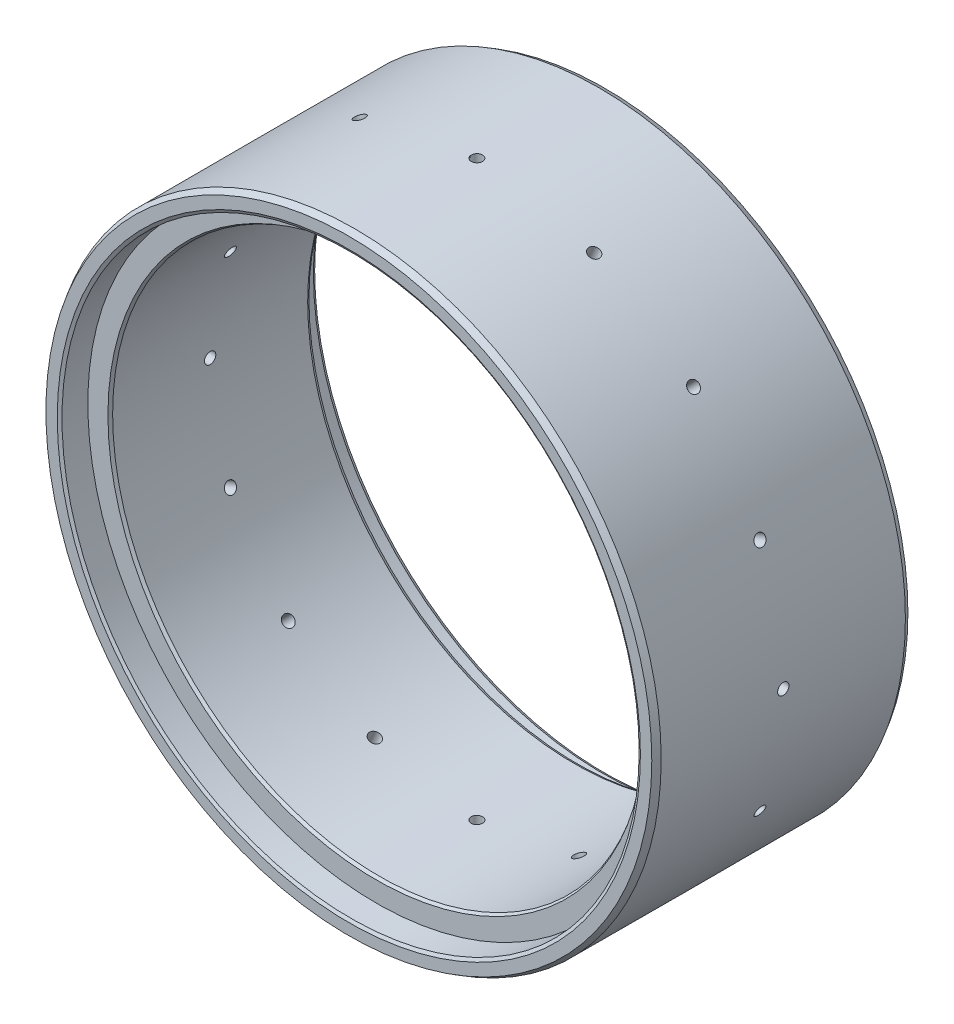
from build123d import *
from OCP.BRepFilletAPI import BRepFilletAPI_MakeChamfer

# Parameters (mm, degrees)
SKETCH1_R         = 67.7545
SKETCH1_R_2       = 58.9915
EXTRUDE1_DEPTH    = 28.321
SKETCH11_R        = 63.8175
EXTRUDE2_DEPTH    = 6.096
CIRPATTERN1_COUNT = 16
CHAMFER1_SIZE     = 0.381
CHAMFER1_SIZE2    = 0.659911358
CHAMFER3_SIZE     = 0.762
CHAMFER3_SIZE2    = 1.319822715


with BuildPart() as part:
    # Sketch1 → Extrude1 (new, symmetric)
    with BuildSketch(Plane.XY):
        Circle(SKETCH1_R)
        Circle(SKETCH1_R_2, mode=Mode.SUBTRACT)
    extrude(amount=EXTRUDE1_DEPTH, both=True)

    # Sketch11 → Extrude2 (cut)
    with BuildSketch(Plane(origin=(0, 0, -28.321), x_dir=(-1, 0, 0), z_dir=(0, 0, -1))):
        Circle(SKETCH11_R)
    extrude2 = extrude(amount=-EXTRUDE2_DEPTH, mode=Mode.SUBTRACT)

    # Mirror1: Extrude2 across plane
    add(extrude2.mirror(Plane.XY), mode=Mode.SUBTRACT)

    # Sketch4 → Tap Drill for M3x0.5 Tap1 (revolve, cut)
    with BuildSketch(Plane(origin=(0, 67.7545, 0), x_dir=(0, 0, 1), z_dir=(1, 0, 0))):
        Polygon((0, 0), (0, 10.911075774), (1.25, 10.16), (1.25, 0), align=None)
    tap_drill_for_m3x0_5_tap1 = revolve(axis=Axis((0, 74.1045, 0), (0, -1, 0)), mode=Mode.SUBTRACT)

    # CirPattern1: Tap Drill for M3x0.5 Tap1 ×16 about axis
    cirpattern1_axis = Axis((0, 0, 28.321), (0, 0, -1))
    for i in range(1, CIRPATTERN1_COUNT):
        add(tap_drill_for_m3x0_5_tap1.rotate(cirpattern1_axis, i * 360 / CIRPATTERN1_COUNT), mode=Mode.SUBTRACT)

    # Chamfer1: one chamfer whose edges measure the first distance from different faces: ONE call of the kernel's chamfer builder (chamfer() names one face for all edges)
    chamfer1_edges_1 = [part.edges().sort_by_distance(p)[0] for p in [
        (-58.9915, 0, -22.225),
    ]]
    chamfer1_side_1 = [part.faces().sort_by_distance(p)[0] for p in [
        (62.01246852, 0, -22.225),
    ]]
    chamfer1_edges_2 = [part.edges().sort_by_distance(p)[0] for p in [
        (63.8175, 0, 28.321),
    ]]
    chamfer1_side_2 = [part.faces().sort_by_distance(p)[0] for p in [
        (63.8175, 0, 25.273),
    ]]
    chamfer1_edges_3 = [part.edges().sort_by_distance(p)[0] for p in [
        (-58.9915, 0, 22.225),
    ]]
    chamfer1_side_3 = [part.faces().sort_by_distance(p)[0] for p in [
        (62.01246852, 0, 22.225),
    ]]
    chamfer1_edges_4 = [part.edges().sort_by_distance(p)[0] for p in [
        (63.8175, 0, -28.321),
    ]]
    chamfer1_side_4 = [part.faces().sort_by_distance(p)[0] for p in [
        (-65.838113344, 0, -28.321),
    ]]
    chamfer1 = BRepFilletAPI_MakeChamfer(part.part.solid().wrapped)
    for e in chamfer1_edges_1:
        chamfer1.Add(CHAMFER1_SIZE, CHAMFER1_SIZE2, e.wrapped, chamfer1_side_1[0].wrapped)  # the first distance lies on this face
    for e in chamfer1_edges_2:
        chamfer1.Add(CHAMFER1_SIZE, CHAMFER1_SIZE2, e.wrapped, chamfer1_side_2[0].wrapped)  # the first distance lies on this face
    for e in chamfer1_edges_3:
        chamfer1.Add(CHAMFER1_SIZE, CHAMFER1_SIZE2, e.wrapped, chamfer1_side_3[0].wrapped)  # the first distance lies on this face
    for e in chamfer1_edges_4:
        chamfer1.Add(CHAMFER1_SIZE, CHAMFER1_SIZE2, e.wrapped, chamfer1_side_4[0].wrapped)  # the first distance lies on this face
    add(Compound.cast(chamfer1.Shape()), mode=Mode.REPLACE)

    # Chamfer3: one chamfer whose edges measure the first distance from different faces: ONE call of the kernel's chamfer builder (chamfer() names one face for all edges)
    chamfer3_edges_1 = [part.edges().sort_by_distance(p)[0] for p in [
        (-67.7545, 0, 28.321),
    ]]
    chamfer3_side_1 = [part.faces().sort_by_distance(p)[0] for p in [
        (66.393798014, 0, 28.321),
    ]]
    chamfer3_edges_2 = [part.edges().sort_by_distance(p)[0] for p in [
        (-67.7545, 0, -28.321),
    ]]
    chamfer3_side_2 = [part.faces().sort_by_distance(p)[0] for p in [
        (66.114886656, 0, -28.321),
    ]]
    chamfer3 = BRepFilletAPI_MakeChamfer(part.part.solid().wrapped)
    for e in chamfer3_edges_1:
        chamfer3.Add(CHAMFER3_SIZE, CHAMFER3_SIZE2, e.wrapped, chamfer3_side_1[0].wrapped)  # the first distance lies on this face
    for e in chamfer3_edges_2:
        chamfer3.Add(CHAMFER3_SIZE, CHAMFER3_SIZE2, e.wrapped, chamfer3_side_2[0].wrapped)  # the first distance lies on this face
    add(Compound.cast(chamfer3.Shape()), mode=Mode.REPLACE)


solid = part.part
